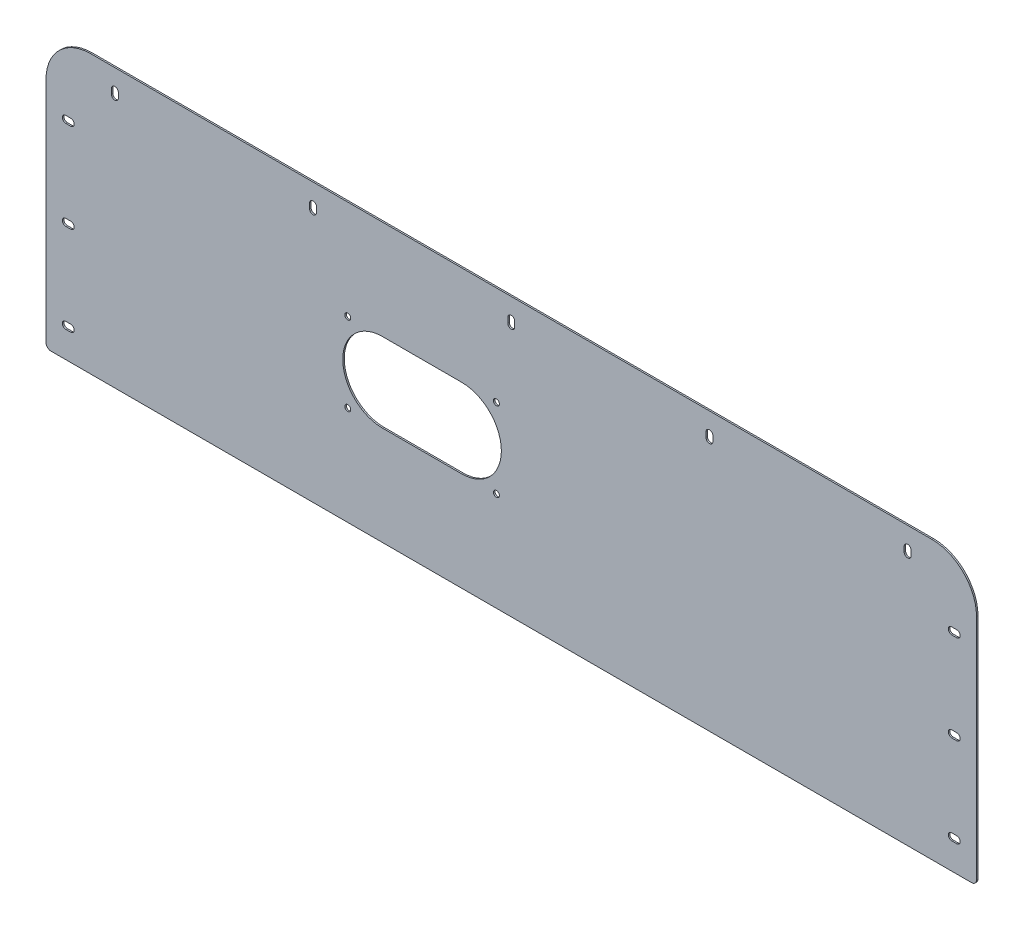
from build123d import *

# Parameters (mm, degrees)
SKETCH_1_W             = 939
SKETCH_1_H             = 280
SM_BASE_FLANGE_1_DEPTH = 1.5
CUT_EXTRUDE_1_DEPTH    = 10
FILLET_1_R             = 45
FILLET_2_R             = 5
CUT_EXTRUDE_2_DEPTH    = 10
PATTERN_LINEAR_1_COUNT = 5
PATTERN_LINEAR_1_PITCH = 200
CUT_EXTRUDE_3_DEPTH    = 10
PATTERN_LINEAR_2_COUNT = 3
PATTERN_LINEAR_2_PITCH = 90
SKETCH_36_R            = 3
CUT_EXTRUDE_4_DEPTH    = 10


# Sheet-metal steps are written as plain solids
with BuildPart() as part:
    # Sketch 1 → 基体-法兰1 (new body)
    with BuildSketch(Plane.XY):
        Rectangle(SKETCH_1_W, SKETCH_1_H)
    extrude(amount=-SM_BASE_FLANGE_1_DEPTH)

    # 草图33 → 切除-拉伸1 (cut)
    with BuildSketch(Plane(origin=(0, 0, -1.5), x_dir=(-1, 0, 0), z_dir=(0, 0, -1))):
        with BuildLine():
            Line((50, 40), (130, 40))
            ThreePointArc((130, 40), (170, 0), (130, -40))
            Line((130, -40), (50, -40))
            ThreePointArc((50, -40), (10, 0), (50, 40))
        make_face()
    extrude(amount=-CUT_EXTRUDE_1_DEPTH, mode=Mode.SUBTRACT)

    # 圆角1
    fillet_1_edges = [part.edges().sort_by_distance(p)[0] for p in [
        (-469.5, 140, -0.75),
        (469.5, 140, -0.75),
    ]]
    fillet(fillet_1_edges, radius=FILLET_1_R)

    # 圆角2
    fillet_2_edges = [part.edges().sort_by_distance(p)[0] for p in [
        (469.5, -140, -0.75),
        (-469.5, -140, -0.75),
    ]]
    fillet(fillet_2_edges, radius=FILLET_2_R)

    # 草图34 → 切除-拉伸2 (cut)
    with BuildSketch(Plane(origin=(0, 0, -1.5), x_dir=(-1, 0, 0), z_dir=(0, 0, -1))):
        with BuildLine():
            Line((-396.5, 120), (-396.5, 115))
            ThreePointArc((-396.5, 115), (-400, 111.5), (-403.5, 115))
            Line((-403.5, 115), (-403.5, 120))
            ThreePointArc((-403.5, 120), (-400, 123.5), (-396.5, 120))
        make_face()
    cut_extrude_2 = extrude(amount=-CUT_EXTRUDE_2_DEPTH, mode=Mode.SUBTRACT)

    # 阵列(线性)1: 切除-拉伸2 ×5
    with Locations(*[(-i * PATTERN_LINEAR_1_PITCH, 0, 0) for i in range(1, PATTERN_LINEAR_1_COUNT)]):
        add(cut_extrude_2, mode=Mode.SUBTRACT)

    # 草图35 → 切除-拉伸3 (cut)
    with BuildSketch(Plane(origin=(0, 0, -1.5), x_dir=(-1, 0, 0), z_dir=(0, 0, -1))):
        with BuildLine():
            Line((-449.5, -106.5), (-444.5, -106.5))
            ThreePointArc((-444.5, -106.5), (-441, -110), (-444.5, -113.5))
            Line((-444.5, -113.5), (-449.5, -113.5))
            ThreePointArc((-449.5, -113.5), (-453, -110), (-449.5, -106.5))
        make_face()
        with BuildLine():
            Line((444.5, -106.5), (449.5, -106.5))
            ThreePointArc((449.5, -106.5), (453, -110), (449.5, -113.5))
            Line((449.5, -113.5), (444.5, -113.5))
            ThreePointArc((444.5, -113.5), (441, -110), (444.5, -106.5))
        make_face()
    cut_extrude_3 = extrude(amount=-CUT_EXTRUDE_3_DEPTH, mode=Mode.SUBTRACT)

    # 阵列(线性)2: 切除-拉伸3 ×3
    with Locations(*[(0, i * PATTERN_LINEAR_2_PITCH, 0) for i in range(1, PATTERN_LINEAR_2_COUNT)]):
        add(cut_extrude_3, mode=Mode.SUBTRACT)

    # 草图36 → 切除-拉伸4 (cut)
    with BuildSketch(Plane(origin=(0, 0, -1.5), x_dir=(-1, 0, 0), z_dir=(0, 0, -1))):
        with Locations((15, 40)):
            Circle(SKETCH_36_R)
        with Locations((165, 40)):
            Circle(SKETCH_36_R)
        with Locations((165, -40)):
            Circle(SKETCH_36_R)
        with Locations((15, -40)):
            Circle(SKETCH_36_R)
    extrude(amount=-CUT_EXTRUDE_4_DEPTH, mode=Mode.SUBTRACT)


solid = part.part
